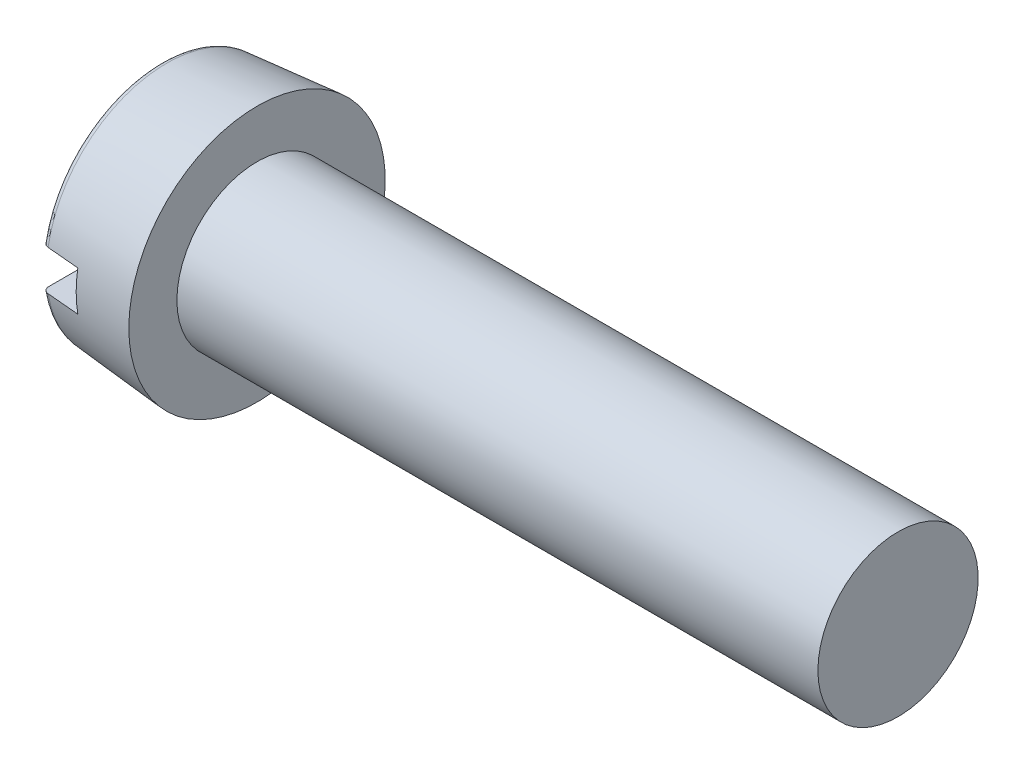
from build123d import *

# Parameters (mm, degrees)
FILLET1_R  = 0.4
SLOTSKE_W  = 16
SLOTSKE_H  = 2.5
SLOT_DEPTH = 2.4


with BuildPart() as part:
    # BodySke → BaseBody (revolve)
    with BuildSketch(Plane.XY):
        Polygon((0, 0), (0, 7.475068019), (6, 8), (6, 5), (46, 5), (46, 0), align=None)
    revolve(axis=Axis((0, 0, 0), (1, 0, 0)))

    # Fillet1
    fillet1_edges = [part.edges().sort_by_distance(p)[0] for p in [
        (0, -7.475068019, 0),
    ]]
    fillet(fillet1_edges, radius=FILLET1_R)

    # SlotSke → Slot (cut)
    with BuildSketch(Plane.ZY):
        Rectangle(SLOTSKE_W, SLOTSKE_H)
    extrude(amount=-SLOT_DEPTH, mode=Mode.SUBTRACT)


solid = part.part
